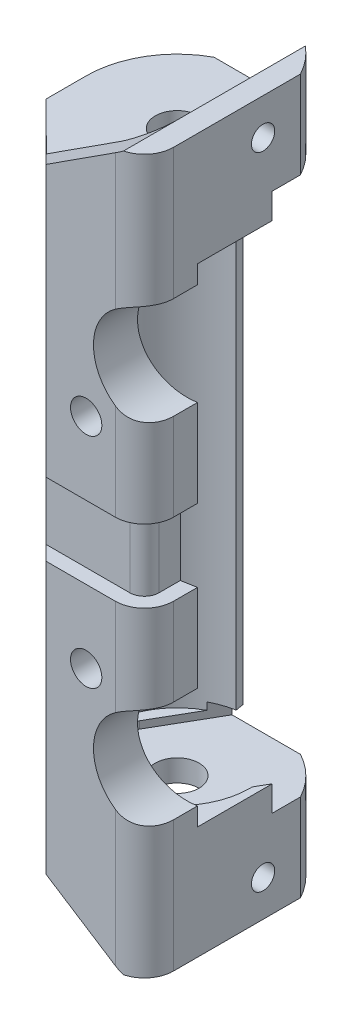
from build123d import *

# Parameters (mm, degrees)
EXTRUDE_1_DEPTH                  = 80
CUT_EXTRUDE_1_REACH              = 83.93
CUT_EXTRUDE_3_REACH              = 83.93
SKETCH_3_W                       = 14.5
SKETCH_3_H                       = 0.5
SKETCH_4_W                       = 11.874342088
SKETCH_4_H                       = 9
SKETCH_4_R                       = 1.6
EXTRUDE_2_DEPTH                  = 3
CUT_EXTRUDE_4_REACH              = 92.739
SKETCH_6_W                       = 22.185119343
SKETCH_6_H                       = 67
EXTRUDE_5_REACH                  = 94.895
EXTRUDE_5_END_RADIUS             = 12.5
SKETCH_8_W                       = 6.562828956
SKETCH_8_H                       = 80
CUT_EXTRUDE_5_REACH              = 95.153
SKETCH_9_R                       = 7
SKETCH_10_W                      = 10.340481407
SKETCH_10_H                      = 67
CUT_EXTRUDE_6_DEPTH              = 2.242898
EXTRUDE_6_DEPTH                  = 6.562828956
EXTRUDE_START                    = -3
EXTRUDE_7_DEPTH                  = 3
EXTRUDE_START_2                  = 1
EXTRUDE_9_DEPTH                  = 1
CUT_EXTRUDE_START                = 2
CUT_EXTRUDE_7_DEPTH              = 2
EXTRUDE_10_REACH                 = 95.153
EXTRUDE_10_END_RADIUS            = 12.5
SKETCH_17_W                      = 12.5
SKETCH_17_H                      = 80
CUT_EXTRUDE_8_REACH              = 92.494
SKETCH_16_W                      = 5
SKETCH_16_H                      = 4
EXTRUDE_11_REACH                 = 92.739
SKETCH_13_W                      = 1
SKETCH_13_H                      = 2.5
EXTRUDE_12_DEPTH                 = 0.5
CUT_EXTRUDE_9_REACH              = 92.494
SKETCH_19_W                      = 5
SKETCH_19_H                      = 4
CUT_EXTRUDE_10_REACH             = 92.739
SKETCH_20_W                      = 11.874342088
SKETCH_20_H                      = 1
CUT_EXTRUDE_11_REACH             = 92.739
SKETCH_21_R                      = 3
CUT_EXTRUDE_12_REACH             = 94.895
SKETCH_22_R                      = 2.15
EXTRUDE_START_3                  = 3
SKETCH_24_R                      = 2.15
EXTRUDE_13_DEPTH                 = 3
SKETCH_25_W                      = 5.773502692
SKETCH_25_H                      = 4
CUT_EXTRUDE_13_DEPTH             = 3.464101615
CUT_EXTRUDE_14_REACH             = 93.2
CUT_EXTRUDE_14_DIRECTION_2_REACH = 93.2
FILLET_1_R                       = 4
SKETCH_28_W                      = 23.5
SKETCH_28_H                      = 10
CUT_EXTRUDE_16_DEPTH             = 2
EXTRUDE_14_REACH                 = 94.395
EXTRUDE_14_END_RADIUS            = 12.5
SKETCH_29_W                      = 3
SKETCH_29_H                      = 9
CUT_EXTRUDE_17_REACH             = 94.77
CUT_EXTRUDE_17_DIRECTION_2_REACH = 94.77
CUT_EXTRUDE_18_REACH             = 95.153
SKETCH_31_W                      = 2
SKETCH_31_H                      = 10
FILLET_2_R                       = 2
CUT_EXTRUDE_19_DEPTH             = 74


with BuildPart() as part:
    # 草图1 → 凸台-拉伸1 (new body)
    with BuildSketch(Plane(origin=(0, 0, 0), x_dir=(1, 0, 0), z_dir=(0, 1, 0))):
        with BuildLine():
            Line((0, 12.5), (11, 12.5))
            Line((11, 12.5), (11, 10))
            Line((11, 10), (0, 10))
            ThreePointArc((0, 10), (-10, 0), (0, -10))
            ThreePointArc((0, -10), (7.071067812, -7.071067812), (10, 0))
            Line((10, 0), (11, 0))
            Line((11, 0), (11, -5.937171044))
            ThreePointArc((11, -5.937171044), (6.404504741, -10.73463176), (0, -12.5))
            ThreePointArc((0, -12.5), (-12.5, 0), (0, 12.5))
        make_face()
    extrude(amount=EXTRUDE_1_DEPTH)

    # 草图2 → 切除-拉伸1 (cut, up to next)
    with BuildSketch(Plane(origin=(0, 80, 0), x_dir=(1, 0, 0), z_dir=(0, 1, 0)), mode=Mode.PRIVATE) as cut_extrude_1_sk1:
        with BuildLine():
            Line((-1.736481777, 9.84807753), (-2.170602221, 12.310096913))
            ThreePointArc((-2.170602221, 12.310096913), (-1.089446784, 12.452433726), (0, 12.5))
            Line((0, 12.5), (11, 12.5))
            Line((11, 12.5), (11, 10))
            Line((11, 10), (0, 10))
            ThreePointArc((0, 10), (-0.871557427, 9.961946981), (-1.736481777, 9.84807753))
        make_face()
    cut_extrude_1_tool1 = extrude(cut_extrude_1_sk1.sketch, amount=-CUT_EXTRUDE_1_REACH, mode=Mode.PRIVATE) & part.part
    add(cut_extrude_1_tool1.solids().sort_by_distance((4.518019, 80, -11.248339))[0], mode=Mode.SUBTRACT)

    # 草图3 → 切除-拉伸3 (cut, up to next)
    with BuildSketch(Plane(origin=(0, 80, 0), x_dir=(1, 0, 0), z_dir=(0, 1, 0)), mode=Mode.PRIVATE) as cut_extrude_3_sk1:
        with Locations((3.75, 12.25)):
            Rectangle(SKETCH_3_W, SKETCH_3_H)
    cut_extrude_3_tool1 = extrude(cut_extrude_3_sk1.sketch, amount=-CUT_EXTRUDE_3_REACH, mode=Mode.PRIVATE) & part.part
    add(cut_extrude_3_tool1.solids().sort_by_distance((3.75, 80, -12.25))[0], mode=Mode.SUBTRACT)

    # 草图4 → 凸台-拉伸2 (add)
    # profile 1 of 2: a face of its own
    with BuildSketch(Plane(origin=(11, 0, 0), x_dir=(0, 0, -1), z_dir=(1, 0, 0))):
        with Locations((0, 84.5)):
            Rectangle(SKETCH_4_W, SKETCH_4_H)
        with Locations((0.8, 84)):
            Circle(SKETCH_4_R, mode=Mode.SUBTRACT)
    # profile 2 of 2: a face of its own
    with BuildSketch(Plane(origin=(11, 0, 0), x_dir=(0, 0, -1), z_dir=(1, 0, 0))):
        with Locations((0, -4.5)):
            Rectangle(SKETCH_4_W, SKETCH_4_H)
        with Locations((0.8, -4)):
            Circle(SKETCH_4_R, mode=Mode.SUBTRACT)
    extrude(amount=-EXTRUDE_2_DEPTH)

    # 草图6 → 切除-拉伸4 (cut, up to next)
    with BuildSketch(Plane(origin=(0, 0, 0), x_dir=(-0.17364817766692378, 0, -0.9848077530122094), z_dir=(0.9848077530122094, 0, -0.17364817766692378)), mode=Mode.PRIVATE) as cut_extrude_4_sk1:
        with Locations((1.092559672, 40)):
            Rectangle(SKETCH_6_W, SKETCH_6_H)
    cut_extrude_4_tool1 = extrude(cut_extrude_4_sk1.sketch, amount=CUT_EXTRUDE_4_REACH, mode=Mode.PRIVATE) & part.part
    add(cut_extrude_4_tool1.solids().sort_by_distance((-0.189721, 40, -1.075961))[0], mode=Mode.SUBTRACT)

    # 凸台-拉伸5: up to this cylinder (the profile starts outside it)
    extrude_5_end = Plane(origin=(0, 40, 0), z_dir=(0, -1, 0)) * Cylinder(EXTRUDE_5_END_RADIUS, 215.79, mode=Mode.PRIVATE)
    # 草图8 → 凸台-拉伸5 (add, up to the surface)
    with BuildSketch(Plane(origin=(11, 0, 0), x_dir=(0, 0, -1), z_dir=(1, 0, 0)), mode=Mode.PRIVATE) as extrude_5_sk1:
        with Locations((-9.218585522, 40)):
            Rectangle(SKETCH_8_W, SKETCH_8_H)
    extrude_5_tool1 = extrude(extrude_5_sk1.sketch, amount=-EXTRUDE_5_REACH, mode=Mode.PRIVATE) - extrude_5_end
    add(extrude_5_tool1.solids().sort_by_distance((11, 40, 9.218586))[0])

    # 草图9 → 切除-拉伸5 (cut, up to next)
    with BuildSketch(Plane.XY.offset(12.5), mode=Mode.PRIVATE) as cut_extrude_5_sk1:
        with Locations((11, 64)):
            Circle(SKETCH_9_R)
    cut_extrude_5_tool1 = extrude(cut_extrude_5_sk1.sketch, amount=-CUT_EXTRUDE_5_REACH, mode=Mode.PRIVATE) & part.part
    # 草图9 → 切除-拉伸5 (cut, up to next)
    with BuildSketch(Plane.XY.offset(12.5), mode=Mode.PRIVATE) as cut_extrude_5_sk2:
        with Locations((11, 16)):
            Circle(SKETCH_9_R)
    cut_extrude_5_tool2 = extrude(cut_extrude_5_sk2.sketch, amount=-CUT_EXTRUDE_5_REACH, mode=Mode.PRIVATE) & part.part
    add(cut_extrude_5_tool1.solids().sort_by_distance((11, 64, 12.5))[0], mode=Mode.SUBTRACT)
    add(cut_extrude_5_tool2.solids().sort_by_distance((11, 16, 12.5))[0], mode=Mode.SUBTRACT)

    # 草图10 → 切除-拉伸6 (cut)
    with BuildSketch(Plane(origin=(1.736481777, 0, 9.84807753), x_dir=(-0.9848077530122094, 0, 0.17364817766692378), z_dir=(-0.17364817766692378, 0, -0.9848077530122094))):
        with Locations((-5.170240704, 40)):
            Rectangle(SKETCH_10_W, SKETCH_10_H)
    extrude(amount=CUT_EXTRUDE_6_DEPTH, mode=Mode.SUBTRACT)

    # 草图11 → 凸台-拉伸6 (add)
    with BuildSketch(Plane.XY.offset(5.937171044)):
        Polygon((11, 80), (11, 89), (8, 89), (8, 80), (8.04673847, 80), align=None)
        Polygon((11, -9), (11, 0), (8.04673847, 0), (8, 0), (8, -9), align=None)
    extrude(amount=EXTRUDE_6_DEPTH)

    # 草图12 → 凸台-拉伸7 (add)
    with BuildSketch(Plane(origin=(0, 80, 0), x_dir=(1, 0, 0), z_dir=(0, 1, 0)).offset(EXTRUDE_START)):
        with BuildLine():
            Line((0, -12.5), (11, -12.5))
            Line((11, -12.5), (11, 5.937171044))
            ThreePointArc((11, 5.937171044), (7.858242408, 9.721009529), (3.5, 12))
            Line((3.5, 12), (-3.5, 12))
            ThreePointArc((-3.5, 12), (-12.374368671, -1.767766953), (0, -12.5))
        make_face()
    extrude_7 = extrude(amount=EXTRUDE_7_DEPTH)

    # 草图14 → 凸台-拉伸9 (add)
    with BuildSketch(Plane.XZ.offset(-77).offset(EXTRUDE_START_2)):
        with BuildLine():
            Line((-7.361215932, -4.25), (-4.727302494, -8.812071898))
            ThreePointArc((-4.727302494, -8.812071898), (-5.134538687, 8.581171975), (10, 0))
            Line((10, 0), (11, 0))
            Line((11, 0), (11, -2.052558883))
            Line((11, -2.052558883), (7.361215932, 4.25))
            ThreePointArc((7.361215932, 4.25), (-4.25, 7.361215932), (-7.361215932, -4.25))
        make_face()
    extrude_9 = extrude(amount=-EXTRUDE_9_DEPTH)

    # 草图15 → 切除-拉伸7 (cut)
    with BuildSketch(Plane.XZ.offset(-77).offset(CUT_EXTRUDE_START)):
        with BuildLine():
            Line((-4.727302494, -8.812071898), (-2.886751346, -12))
            Line((-2.886751346, -12), (-2.115923769, -12))
            Line((-2.115923769, -12), (-1.736481777, -9.84807753))
            ThreePointArc((-1.736481777, -9.84807753), (-3.273141258, -9.449155852), (-4.727302494, -8.812071898))
        make_face()
    cut_extrude_7 = extrude(amount=-CUT_EXTRUDE_7_DEPTH, mode=Mode.SUBTRACT)

    # 凸台-拉伸10: up to this cylinder (the profile starts outside it)
    extrude_10_end = Plane(origin=(0, 40, 0), z_dir=(0, -1, 0)) * Cylinder(EXTRUDE_10_END_RADIUS, 216.306, mode=Mode.PRIVATE)
    # 草图17 → 凸台-拉伸10 (add, up to the surface)
    with BuildSketch(Plane.XY.offset(12.5), mode=Mode.PRIVATE) as extrude_10_sk1:
        with Locations((-6.25, 40)):
            Rectangle(SKETCH_17_W, SKETCH_17_H)
    extrude_10_tool1 = extrude(extrude_10_sk1.sketch, amount=-EXTRUDE_10_REACH, mode=Mode.PRIVATE) - extrude_10_end
    extrude_10 = extrude_10_tool1.solids().sort_by_distance((-6.25, 40, 12.5))[0]
    add(extrude_10)

    # 切除-拉伸8: up to this plane
    cut_extrude_8_end = Plane(origin=(-12.501, 80, 12.5), z_dir=(0, 0, 1))
    # 草图16 → 切除-拉伸8 (cut, up to the surface)
    with BuildSketch(Plane(origin=(-2.886751346, 77, -12), x_dir=(0.8660254037844382, 0, 0.500000000000001), z_dir=(-0.5000000000000009, 0, 0.866025403784438)), mode=Mode.PRIVATE) as cut_extrude_8_sk1:
        with Locations((8.464101615, -2)):
            Rectangle(SKETCH_16_W, SKETCH_16_H)
    cut_extrude_8_tool1 = split(extrude(cut_extrude_8_sk1.sketch, amount=CUT_EXTRUDE_8_REACH, mode=Mode.PRIVATE), bisect_by=cut_extrude_8_end, keep=Keep.BOTH, mode=Mode.PRIVATE)
    cut_extrude_8 = cut_extrude_8_tool1.solids().sort_by_distance((4.443376, 75, -7.767949))[0]
    add(cut_extrude_8, mode=Mode.SUBTRACT)

    # 镜向2: 凸台-拉伸7, 凸台-拉伸9, 切除-拉伸7, 凸台-拉伸10, 切除-拉伸8 across plane
    add(extrude_7.mirror(Plane.ZX.offset(40)))
    add(extrude_9.mirror(Plane.ZX.offset(40)))
    add(cut_extrude_7.mirror(Plane.ZX.offset(40)), mode=Mode.SUBTRACT)
    add(extrude_10.mirror(Plane.ZX.offset(40)))
    add(cut_extrude_8.mirror(Plane.ZX.offset(40)), mode=Mode.SUBTRACT)

    # 凸台-拉伸11: up to this plane
    extrude_11_end = Plane(origin=(7.361215932, 76, 4.25), z_dir=(0.8660254037844382, 0, 0.500000000000001))
    # 草图13 → 凸台-拉伸11 (add, up to the surface)
    with BuildSketch(Plane(origin=(0, 0, 0), x_dir=(-1, 0, 0), z_dir=(0, 0, -1)), mode=Mode.PRIVATE) as extrude_11_sk1:
        with Locations((-10.5, 74.75)):
            Rectangle(SKETCH_13_W, SKETCH_13_H)
    extrude_11_tool1 = split(extrude(extrude_11_sk1.sketch, amount=EXTRUDE_11_REACH, mode=Mode.PRIVATE), bisect_by=extrude_11_end, keep=Keep.BOTH, mode=Mode.PRIVATE)
    add(extrude_11_tool1.solids().sort_by_distance((10.5, 74.75, 0))[0])
    # 草图13 → 凸台-拉伸11 (add, up to the surface)
    with BuildSketch(Plane(origin=(0, 0, 0), x_dir=(-1, 0, 0), z_dir=(0, 0, -1)), mode=Mode.PRIVATE) as extrude_11_sk2:
        with Locations((-10.5, 5.25)):
            Rectangle(SKETCH_13_W, SKETCH_13_H)
    extrude_11_tool2 = split(extrude(extrude_11_sk2.sketch, amount=EXTRUDE_11_REACH, mode=Mode.PRIVATE), bisect_by=extrude_11_end, keep=Keep.BOTH, mode=Mode.PRIVATE)
    add(extrude_11_tool2.solids().sort_by_distance((10.5, 5.25, 0))[0])

    # 草图18 → 凸台-拉伸12 (add)
    with BuildSketch(Plane.XY.offset(12.5)):
        Polygon((8, 80), (8, 89), (-12.5, 80), align=None)
        Polygon((-12.5, 0), (8, 0), (8, -9), align=None)
    extrude(amount=-EXTRUDE_12_DEPTH)

    # 草图19 → 切除-拉伸9 (cut, up to next)
    with BuildSketch(Plane(origin=(-2.886751346, 77, -12), x_dir=(0.8660254037844382, 0, 0.500000000000001), z_dir=(-0.5000000000000009, 0, 0.866025403784438)), mode=Mode.PRIVATE) as cut_extrude_9_sk1:
        with Locations((8.464101615, -2)):
            Rectangle(SKETCH_19_W, SKETCH_19_H)
    cut_extrude_9_tool1 = extrude(cut_extrude_9_sk1.sketch, amount=CUT_EXTRUDE_9_REACH, mode=Mode.PRIVATE) & part.part
    add(cut_extrude_9_tool1.solids().sort_by_distance((4.443376, 75, -7.767949))[0], mode=Mode.SUBTRACT)

    # 草图20 → 切除-拉伸10 (cut, up to next)
    with BuildSketch(Plane(origin=(0, 80, 0), x_dir=(1, 0, 0), z_dir=(0, 1, 0)), mode=Mode.PRIVATE) as cut_extrude_10_sk1:
        with Locations((0, 11.5)):
            Rectangle(SKETCH_20_W, SKETCH_20_H)
    cut_extrude_10_tool1 = extrude(cut_extrude_10_sk1.sketch, amount=-CUT_EXTRUDE_10_REACH, mode=Mode.PRIVATE) & part.part
    add(cut_extrude_10_tool1.solids().sort_by_distance((0, 80, -11.5))[0], mode=Mode.SUBTRACT)

    # 切除-拉伸11: up to this face of the body (flat: up to its plane)
    cut_extrude_11_end = Plane(part.part.faces().sort_by_distance((-1.739444803, 0, 0.833680273))[0])
    # 草图21 → 切除-拉伸11 (cut, up to the picked face)
    with BuildSketch(Plane(origin=(0, 80, 0), x_dir=(1, 0, 0), z_dir=(0, 1, 0)), mode=Mode.PRIVATE) as cut_extrude_11_sk1:
        with Locations(Location((0, 0, 0), (0, 0, 270))):
            Circle(SKETCH_21_R)
    cut_extrude_11_tool1 = split(extrude(cut_extrude_11_sk1.sketch, amount=-CUT_EXTRUDE_11_REACH, mode=Mode.PRIVATE), bisect_by=cut_extrude_11_end, keep=Keep.BOTH, mode=Mode.PRIVATE)
    add(cut_extrude_11_tool1.solids().sort_by(Axis((0, 80, 0), (0, -1, 0)))[0], mode=Mode.SUBTRACT)

    # 草图22 → 切除-拉伸12 (cut, up to next)
    with BuildSketch(Plane.XY.offset(12.5), mode=Mode.PRIVATE) as cut_extrude_12_sk1:
        with Locations((3, 55)):
            Circle(SKETCH_22_R)
    cut_extrude_12_tool1 = extrude(cut_extrude_12_sk1.sketch, amount=-CUT_EXTRUDE_12_REACH, mode=Mode.PRIVATE) & part.part
    # 草图22 → 切除-拉伸12 (cut, up to next)
    with BuildSketch(Plane.XY.offset(12.5), mode=Mode.PRIVATE) as cut_extrude_12_sk2:
        with Locations(Location((3, 25, 0), (0, 0, 125.992751208))):
            Circle(SKETCH_22_R)
    cut_extrude_12_tool2 = extrude(cut_extrude_12_sk2.sketch, amount=-CUT_EXTRUDE_12_REACH, mode=Mode.PRIVATE) & part.part
    add(cut_extrude_12_tool1.solids().sort_by_distance((3, 55, 12.5))[0], mode=Mode.SUBTRACT)
    add(cut_extrude_12_tool2.solids().sort_by_distance((3, 25, 12.5))[0], mode=Mode.SUBTRACT)

    # 草图24 → 凸台-拉伸13 (add)
    with BuildSketch(Plane.XY.offset(12.5).offset(EXTRUDE_START_3)):
        with BuildLine():
            Line((11, 89), (8, 89))
            Line((8, 89), (-12.5, 80))
            Line((-12.5, 80), (-12.5, 0))
            Line((-12.5, 0), (8, -9))
            Line((8, -9), (11, -9))
            Line((11, -9), (11, 9))
            ThreePointArc((11, 9), (4, 16), (11, 23))
            Line((11, 23), (11, 57))
            ThreePointArc((11, 57), (4, 64), (11, 71))
            Line((11, 71), (11, 89))
        make_face()
        with Locations((3, 25)):
            Circle(SKETCH_24_R, mode=Mode.SUBTRACT)
        with Locations((3, 55)):
            Circle(SKETCH_24_R, mode=Mode.SUBTRACT)
    extrude(amount=-EXTRUDE_13_DEPTH)

    # 草图25 → 切除-拉伸13 (cut, along a direction that is not the sketch's normal)
    with BuildSketch(Plane(origin=(0, 0, 12.5), x_dir=(-1, 0, 0), z_dir=(0, 0, -1))):
        with Locations((7.258330249, 75)):
            Rectangle(SKETCH_25_W, SKETCH_25_H)
        with Locations((7.258330249, 5)):
            Rectangle(SKETCH_25_W, SKETCH_25_H)
    extrude(amount=-CUT_EXTRUDE_13_DEPTH, dir=(0.500000000000001, 0, -0.8660254037844382), mode=Mode.SUBTRACT)

    # 草图26 → 切除-拉伸14 (cut, up to next)
    with BuildSketch(Plane.XZ, mode=Mode.PRIVATE) as cut_extrude_14_sk1:
        Polygon((-2.5, 15.5), (-12.5, 5.5), (-12.5, 15.5), align=None)
    cut_extrude_14_tool1 = extrude(cut_extrude_14_sk1.sketch, amount=-CUT_EXTRUDE_14_REACH, mode=Mode.PRIVATE) & part.part
    add(cut_extrude_14_tool1.solids().sort_by_distance((-9.166667, 0, 12.166667))[0], mode=Mode.SUBTRACT)

    # 草图26 → 切除-拉伸14 direction 2 (cut, up to next)
    with BuildSketch(Plane.XZ, mode=Mode.PRIVATE) as cut_extrude_14_direction_2_sk1:
        Polygon((-2.5, 15.5), (-12.5, 5.5), (-12.5, 15.5), align=None)
    cut_extrude_14_direction_2_tool1 = extrude(cut_extrude_14_direction_2_sk1.sketch, amount=CUT_EXTRUDE_14_DIRECTION_2_REACH, mode=Mode.PRIVATE) & part.part
    add(cut_extrude_14_direction_2_tool1.solids().sort_by_distance((-9.166667, 0, 12.166667))[0], mode=Mode.SUBTRACT)

    # 圆角1
    # the kernel refuses this fillet: 4 mm, written as the material it adds along each edge
    with BuildSketch(Plane(origin=(8, 0, 12), x_dir=(0, 0, -1), z_dir=(0, -1, 0))) as fillet_1_piece_1_section:
        with BuildLine():
            CenterArc((FILLET_1_R, -FILLET_1_R), FILLET_1_R, 90, 90)
            Line((0, -FILLET_1_R), (0, 0))
            Line((0, 0), (FILLET_1_R, 0))
        make_face()
    fillet_1_piece_1 = extrude(amount=19, mode=Mode.PRIVATE)
    fillet_1_piece_1 = split(fillet_1_piece_1, bisect_by=Plane(origin=(6.323842704, -8.264126065, 8.562761733), z_dir=(0.4019900620351977, 0.9156440301912845, 0)), keep=Keep.TOP, mode=Mode.PRIVATE)
    add(fillet_1_piece_1)
    with BuildSketch(Plane(origin=(8, 70, 12), x_dir=(-1, 0, 0), z_dir=(0, 1, 0))) as fillet_1_piece_2_section:
        with BuildLine():
            CenterArc((FILLET_1_R, -FILLET_1_R), FILLET_1_R, 90, 90)
            Line((0, -FILLET_1_R), (0, 0))
            Line((0, 0), (FILLET_1_R, 0))
        make_face()
    fillet_1_piece_2 = extrude(amount=29, mode=Mode.PRIVATE)
    fillet_1_piece_2 = split(fillet_1_piece_2, bisect_by=Plane(origin=(5.544544568, 87.921995176, 11.103304209), z_dir=(0.40199006203519777, -0.9156440301912845, 0)), keep=Keep.TOP, mode=Mode.PRIVATE)
    fillet_1_piece_2 = split(fillet_1_piece_2, bisect_by=Plane(origin=(7.130662973, 73.5, 11.103304209), z_dir=(0, 1, 0)), keep=Keep.TOP, mode=Mode.PRIVATE)
    add(fillet_1_piece_2)
    # the kernel refuses this fillet: 4 mm, written as the material it takes off along each edge
    with BuildSketch(Plane(origin=(11, -19, 15.5), x_dir=(0, 0, -1), z_dir=(0, 1, 0))) as fillet_1_2_piece_1:
        with BuildLine():
            CenterArc((FILLET_1_R, FILLET_1_R), FILLET_1_R, 180, 90)
            Line((0, FILLET_1_R), (0, 0))
            Line((0, 0), (FILLET_1_R, 0))
        make_face()
    extrude(amount=38, mode=Mode.SUBTRACT)
    with BuildSketch(Plane(origin=(11, 13, 15.5), x_dir=(-1, 0, 0), z_dir=(0, 1, 0))) as fillet_1_2_piece_2:
        with BuildLine():
            CenterArc((FILLET_1_R, -FILLET_1_R), FILLET_1_R, 90, 90)
            Line((0, -FILLET_1_R), (0, 0))
            Line((0, 0), (FILLET_1_R, 0))
        make_face()
    extrude(amount=54, mode=Mode.SUBTRACT)
    with BuildSketch(Plane(origin=(11, 61, 15.5), x_dir=(-1, 0, 0), z_dir=(0, 1, 0))) as fillet_1_2_piece_3:
        with BuildLine():
            CenterArc((FILLET_1_R, -FILLET_1_R), FILLET_1_R, 90, 90)
            Line((0, -FILLET_1_R), (0, 0))
            Line((0, 0), (FILLET_1_R, 0))
        make_face()
    extrude(amount=38, mode=Mode.SUBTRACT)

    # 草图28 → 切除-拉伸16 (cut)
    with BuildSketch(Plane.XY.offset(15.5)):
        with Locations((-0.75, 40)):
            Rectangle(SKETCH_28_W, SKETCH_28_H)
    extrude(amount=-CUT_EXTRUDE_16_DEPTH, mode=Mode.SUBTRACT)

    # 凸台-拉伸14: up to this cylinder (the profile starts inside it)
    extrude_14_end = Plane(origin=(0, 40, 0), z_dir=(0, 1, 0)) * Cylinder(EXTRUDE_14_END_RADIUS, 303.79, mode=Mode.PRIVATE)
    # 草图29 → 凸台-拉伸14 (add, up to the surface)
    with BuildSketch(Plane(origin=(0, 0, -5.937171044), x_dir=(-1, 0, 0), z_dir=(0, 0, -1)), mode=Mode.PRIVATE) as extrude_14_sk1:
        with Locations((-9.5, 84.5)):
            Rectangle(SKETCH_29_W, SKETCH_29_H)
    extrude_14_tool1 = extrude(extrude_14_sk1.sketch, amount=EXTRUDE_14_REACH, mode=Mode.PRIVATE) & extrude_14_end
    add(extrude_14_tool1.solids().sort_by_distance((9.5, 84.5, -5.937171))[0])
    # 草图29 → 凸台-拉伸14 (add, up to the surface)
    with BuildSketch(Plane(origin=(0, 0, -5.937171044), x_dir=(-1, 0, 0), z_dir=(0, 0, -1)), mode=Mode.PRIVATE) as extrude_14_sk2:
        with Locations((-9.5, -4.5)):
            Rectangle(SKETCH_29_W, SKETCH_29_H)
    extrude_14_tool2 = extrude(extrude_14_sk2.sketch, amount=EXTRUDE_14_REACH, mode=Mode.PRIVATE) & extrude_14_end
    add(extrude_14_tool2.solids().sort_by_distance((9.5, -4.5, -5.937171))[0])

    # 草图30 → 切除-拉伸17 (cut, up to next)
    with BuildSketch(Plane(origin=(0, 0, 12), x_dir=(-1, 0, 0), z_dir=(0, 0, -1)), mode=Mode.PRIVATE) as cut_extrude_17_sk1:
        Polygon((-8, 89), (5.937171044, 80), (6, 82.853658537), align=None)
    cut_extrude_17_tool1 = extrude(cut_extrude_17_sk1.sketch, amount=-CUT_EXTRUDE_17_REACH, mode=Mode.PRIVATE) & part.part
    # 草图30 → 切除-拉伸17 (cut, up to next)
    with BuildSketch(Plane(origin=(0, 0, 12), x_dir=(-1, 0, 0), z_dir=(0, 0, -1)), mode=Mode.PRIVATE) as cut_extrude_17_sk2:
        Polygon((6, 0), (-8, -9), (6, -2.853658537), align=None)
    cut_extrude_17_tool2 = extrude(cut_extrude_17_sk2.sketch, amount=-CUT_EXTRUDE_17_REACH, mode=Mode.PRIVATE) & part.part
    add(cut_extrude_17_tool1.solids().sort_by_distance((-1.31239, 83.95122, 12))[0], mode=Mode.SUBTRACT)
    add(cut_extrude_17_tool2.solids().sort_by_distance((-1.333333, -3.95122, 12))[0], mode=Mode.SUBTRACT)

    # 草图30 → 切除-拉伸17 direction 2 (cut, up to next)
    with BuildSketch(Plane(origin=(0, 0, 12), x_dir=(-1, 0, 0), z_dir=(0, 0, -1)), mode=Mode.PRIVATE) as cut_extrude_17_direction_2_sk1:
        Polygon((-8, 89), (5.937171044, 80), (6, 82.853658537), align=None)
    cut_extrude_17_direction_2_tool1 = extrude(cut_extrude_17_direction_2_sk1.sketch, amount=CUT_EXTRUDE_17_DIRECTION_2_REACH, mode=Mode.PRIVATE) & part.part
    # 草图30 → 切除-拉伸17 direction 2 (cut, up to next)
    with BuildSketch(Plane(origin=(0, 0, 12), x_dir=(-1, 0, 0), z_dir=(0, 0, -1)), mode=Mode.PRIVATE) as cut_extrude_17_direction_2_sk2:
        Polygon((6, 0), (-8, -9), (6, -2.853658537), align=None)
    cut_extrude_17_direction_2_tool2 = extrude(cut_extrude_17_direction_2_sk2.sketch, amount=CUT_EXTRUDE_17_DIRECTION_2_REACH, mode=Mode.PRIVATE) & part.part
    add(cut_extrude_17_direction_2_tool1.solids().sort_by_distance((-1.31239, 83.95122, 12))[0], mode=Mode.SUBTRACT)
    add(cut_extrude_17_direction_2_tool2.solids().sort_by_distance((-1.333333, -3.95122, 12))[0], mode=Mode.SUBTRACT)

    # 切除-拉伸18: up to this plane
    cut_extrude_18_end = Plane(origin=(14.458052907, 73.5, 7.604921303), z_dir=(-0.17364817766692378, 0, -0.9848077530122092))
    # 草图31 → 切除-拉伸18 (cut, up to the surface)
    with BuildSketch(Plane.XY.offset(13.5), mode=Mode.PRIVATE) as cut_extrude_18_sk1:
        with Locations((10, 40)):
            Rectangle(SKETCH_31_W, SKETCH_31_H)
    cut_extrude_18_tool1 = split(extrude(cut_extrude_18_sk1.sketch, amount=-CUT_EXTRUDE_18_REACH, mode=Mode.PRIVATE), bisect_by=cut_extrude_18_end, keep=Keep.BOTH, mode=Mode.PRIVATE)
    add(cut_extrude_18_tool1.solids().sort_by_distance((10, 40, 13.5))[0], mode=Mode.SUBTRACT)

    # 圆角2
    fillet_2_edges = [part.edges().sort_by_distance(p)[0] for p in [
        (9, 40, 13.5),
    ]]
    fillet(fillet_2_edges, radius=FILLET_2_R)

    # 草图32 → 切除-拉伸19 (cut)
    with BuildSketch(Plane.XZ.offset(-77)):
        with BuildLine():
            Line((-7.361215932, -4.25), (-8.111215932, -2.950961894))
            ThreePointArc((-8.111215932, -2.950961894), (-5, 8.660254038), (6.611215932, 5.549038106))
            Line((6.611215932, 5.549038106), (7.361215932, 4.25))
            ThreePointArc((7.361215932, 4.25), (4.25, -7.361215932), (-7.361215932, -4.25))
        make_face()
    extrude(amount=CUT_EXTRUDE_19_DEPTH, mode=Mode.SUBTRACT)


solid = part.part
